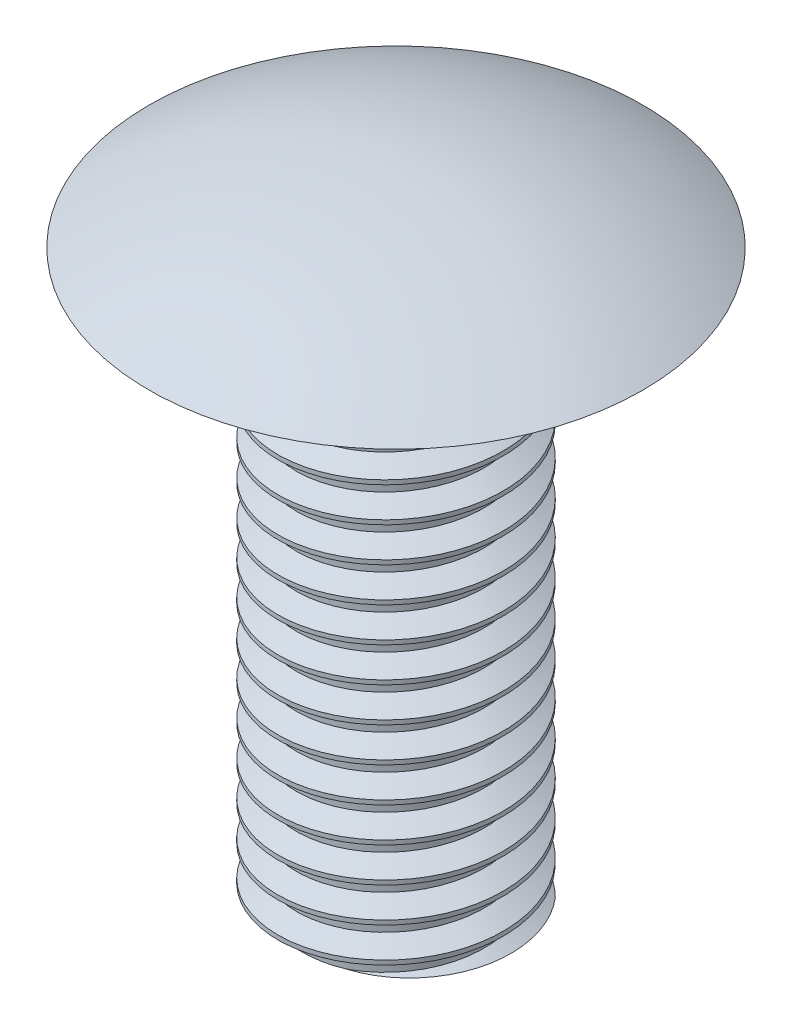
from build123d import *
from build123d.topology import SkipClean

# Parameters (mm, degrees)
THREAD1_PITCH = 1.953846154


with BuildPart() as part:
    # Sketch1 → Revolve1 (revolve)
    with BuildSketch(Plane.XY):
        with BuildLine():
            Line((5.084519573, 14.010676157), (12.65480427, 14.010676157))
            ThreePointArc((12.65480427, 14.010676157), (5.950654724, 16.850976074), (-1.265480427, 17.820676157))
            Line((-1.265480427, 17.820676157), (-1.265480427, 14.010676157))
            Line((-1.265480427, 14.010676157), (-1.265480427, -17.739323843))
            Line((-1.265480427, -17.739323843), (5.084519573, -17.739323843))
            Line((5.084519573, -17.739323843), (5.084519573, 14.010676157))
        make_face()
    revolve(axis=Axis((-1.265480427, 14.010676157, 0), (0, -1, 0)))

    # Thread1: the profile of Thread Profile1 profile screwed along a right-hand helix of 16.25 turns, 10 arcs to a turn; built about Z, then put on its axis
    with SkipClean():  # the faces are left unmerged after this step: merging them gives an invalid solid
        thread1_z = Axis((0, 0, 0), (0, 0, 1))
        thread1_corners = [(6.3503, 0, -0.000173205), (6.3503, 0, 1.709788585), (5.292449752, 0, 1.099038459), (5.292449752, 0, 0.610576921)]
        with BuildLine(mode=Mode.PRIVATE) as thread1_profile:
            Line(thread1_corners[0], thread1_corners[1])
            Line(thread1_corners[1], thread1_corners[2])
            Line(thread1_corners[2], thread1_corners[3])
            Line(thread1_corners[3], thread1_corners[0])
        thread1_cap = Face(thread1_profile.wire())
        thread1_turn_angles = [0, 18, 36, 54, 72, 90, 108, 126, 144, 162, 180, 198, 216, 234, 252, 270, 288, 306, 324, 342, 360]
        thread1_turn_weights = [1, 0.9510565162951535, 1, 0.9510565162951535, 1, 0.9510565162951535, 1, 0.9510565162951535, 1, 0.9510565162951535, 1, 0.9510565162951535, 1, 0.9510565162951535, 1, 0.9510565162951535, 1, 0.9510565162951535, 1, 0.9510565162951535, 1]
        thread1_turn_rails = [Edge.make_bspline([Vector(p[0], p[1], 0).rotate(thread1_z, thread1_turn_angles[k]) / thread1_turn_weights[k] + Vector(0, 0, p[2] + THREAD1_PITCH * thread1_turn_angles[k] / 360) for k in range(21)], [0, 0, 0, 1, 1, 2, 2, 3, 3, 4, 4, 5, 5, 6, 6, 7, 7, 8, 8, 9, 9, 10, 10, 10], 2, thread1_turn_weights) for p in thread1_corners]
        thread1_turn_sides = [Face.make_surface_from_curves(thread1_turn_rails[p[0]], thread1_turn_rails[p[1]]) for p in [(0, 1), (1, 2), (2, 3), (3, 0)]]
        thread1_last_angles = [5760, 5778, 5796, 5814, 5832, 5841, 5850]
        thread1_last_weights = [1, 0.9510565162951535, 1, 0.9510565162951535, 1, 0.987688340595139, 1]
        thread1_last_rails = [Edge.make_bspline([Vector(p[0], p[1], 0).rotate(thread1_z, thread1_last_angles[k]) / thread1_last_weights[k] + Vector(0, 0, p[2] + THREAD1_PITCH * thread1_last_angles[k] / 360) for k in range(7)], [0, 0, 0, 1, 1, 2, 2, 3, 3, 3], 2, thread1_last_weights) for p in thread1_corners]
        thread1_last_sides = [Face.make_surface_from_curves(thread1_last_rails[p[0]], thread1_last_rails[p[1]]) for p in [(0, 1), (1, 2), (2, 3), (3, 0)]]
        thread1 = Plane(origin=(-1.265480427, 14.010676157, 0), x_dir=(-1, 0, 0), z_dir=(0, -1, 0)) * Solid(Shell([*[p.moved(Location((0, 0, THREAD1_PITCH * i))) for i in range(16) for p in thread1_turn_sides], *thread1_last_sides, thread1_cap, thread1_cap.rotate(thread1_z, 5850).moved(Location((0, 0, THREAD1_PITCH * 5850 / 360)))]))
        add(thread1, mode=Mode.SUBTRACT)


solid = part.part
